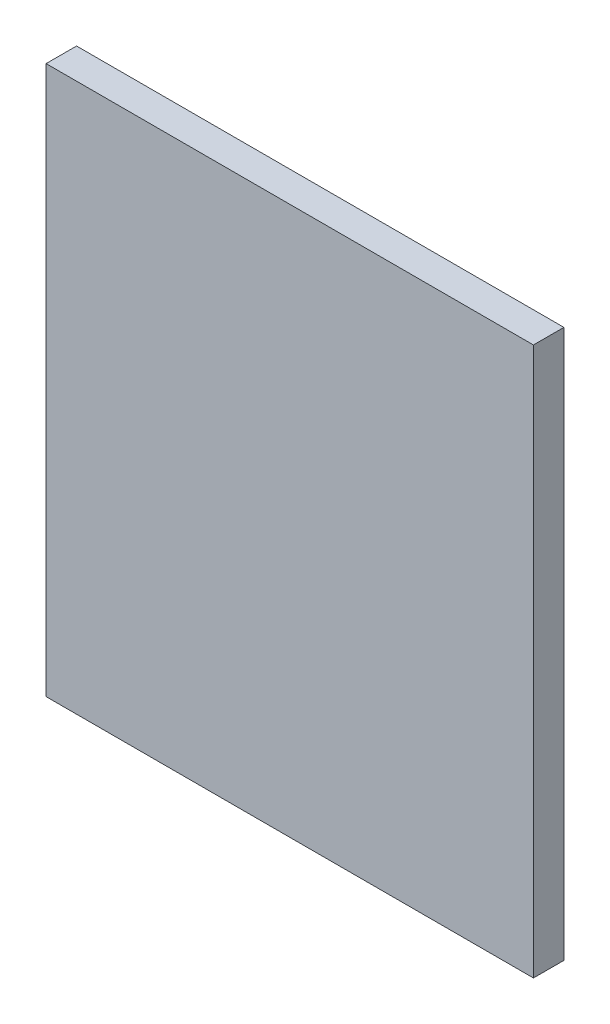
from build123d import *

# Parameters (mm, degrees)
SKETCH1_W           = 101.6
SKETCH1_H           = 114.3
BOSS_EXTRUDE1_DEPTH = 6.35


with BuildPart() as part:
    # Sketch1 → Boss-Extrude1 (new body)
    with BuildSketch(Plane.XY):
        Rectangle(SKETCH1_W, SKETCH1_H)
    extrude(amount=BOSS_EXTRUDE1_DEPTH)


solid = part.part
